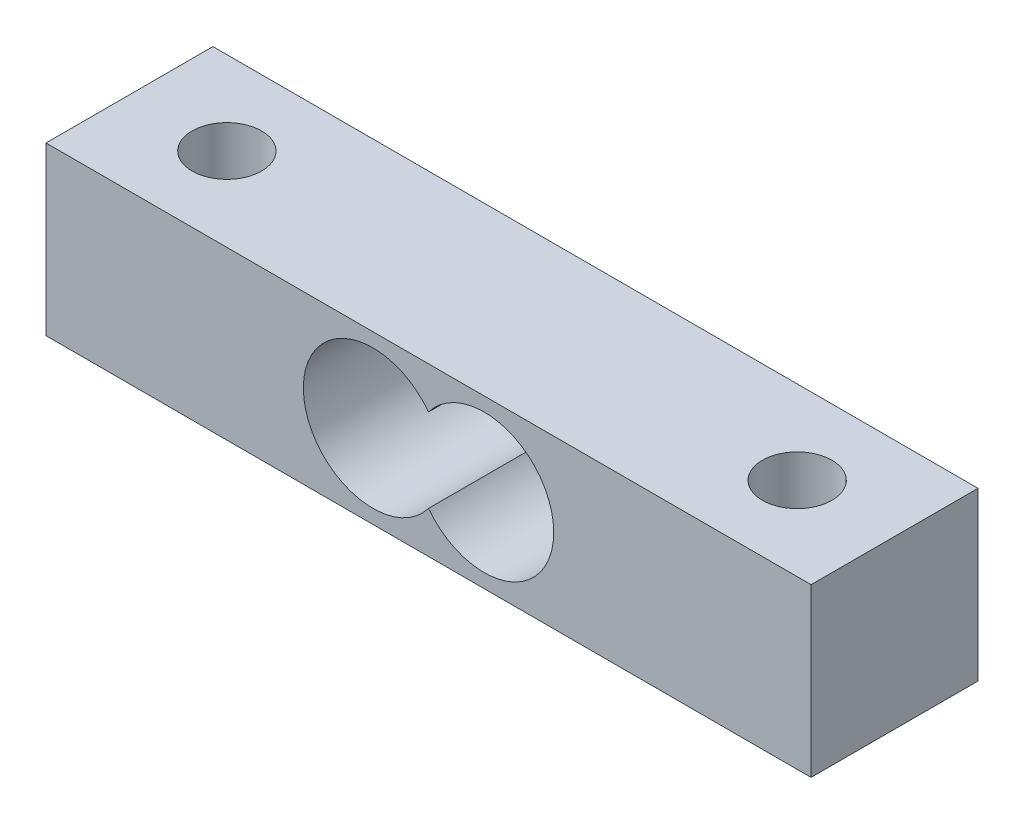
from build123d import *

# Parameters (mm, degrees)
CROQUIS1_W              = 55
CROQUIS1_H              = 12
SALIENTE_EXTRUIR1_DEPTH = 12
TALADRO1_OUTLINE_R      = 2.5
TALADRO1_DEPTH          = 12


# Read off the part's stored shape, not the designer's step: Taladro1
with BuildPart() as part:
    # Croquis1 → Saliente-Extruir1 (new body)
    with BuildSketch(Plane.XY):
        with Locations((27.5, 6)):
            Rectangle(CROQUIS1_W, CROQUIS1_H)
        with BuildLine():
            ThreePointArc((27.5, 9), (18.5, 6), (27.5, 3))
            ThreePointArc((27.5, 3), (36.5, 6), (27.5, 9))
        make_face(mode=Mode.SUBTRACT)
    extrude(amount=SALIENTE_EXTRUIR1_DEPTH)

    # Taladro1 outline → Taladro1 (cut)
    with BuildSketch(Plane(origin=(0, 0, 0), x_dir=(1, 0, 0), z_dir=(0, 1, 0))):
        with Locations((48, -6)):
            Circle(TALADRO1_OUTLINE_R)
        with Locations((7, -6)):
            Circle(TALADRO1_OUTLINE_R)
    extrude(amount=TALADRO1_DEPTH, mode=Mode.SUBTRACT)


solid = part.part
